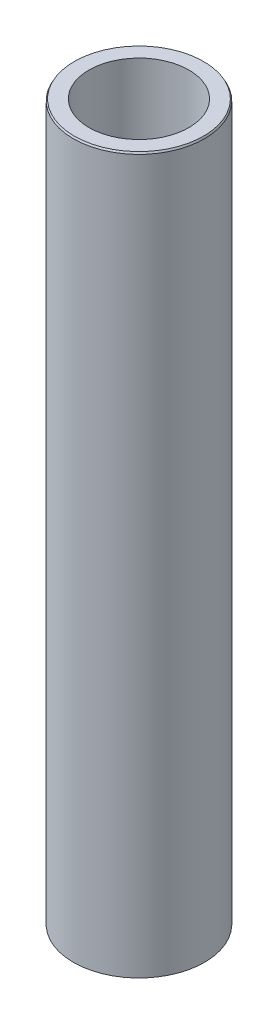
from build123d import *
from OCP.BRepFilletAPI import BRepFilletAPI_MakeChamfer

# Parameters (mm, degrees)
SKETCH1_R           = 55
BOSS_EXTRUDE1_DEPTH = 600
SKETCH2_R           = 41.846324563
CUT_EXTRUDE1_DEPTH  = 606.020660804
CHAMFER1_SIZE       = 1.471821638
CHAMFER1_SIZE2      = 0.810370983


with BuildPart() as part:
    # Sketch1 → Boss-Extrude1 (new body)
    with BuildSketch(Plane(origin=(0, 0, 0), x_dir=(1, 0, 0), z_dir=(0, 1, 0))):
        Circle(SKETCH1_R)
    extrude(amount=BOSS_EXTRUDE1_DEPTH)

    # Sketch2 → Cut-Extrude1 (cut, through all)
    with BuildSketch(Plane(origin=(0, 0, 0), x_dir=(1, 0, 0), z_dir=(0, 1, 0))):
        Circle(SKETCH2_R)
    extrude(amount=CUT_EXTRUDE1_DEPTH, mode=Mode.SUBTRACT)

    # Chamfer1: one chamfer whose edges measure the first distance from different faces: ONE call of the kernel's chamfer builder (chamfer() names one face for all edges)
    chamfer1_edges_1 = [part.edges().sort_by_distance(p)[0] for p in [
        (-55, 600, 0),
    ]]
    chamfer1_side_1 = [part.faces().sort_by_distance(p)[0] for p in [
        (-55, 300, 0),
    ]]
    chamfer1_edges_2 = [part.edges().sort_by_distance(p)[0] for p in [
        (-55, 0, 0),
    ]]
    chamfer1_side_2 = [part.faces().sort_by_distance(p)[0] for p in [
        (-53.444365081, 0, 0),
    ]]
    chamfer1 = BRepFilletAPI_MakeChamfer(part.part.solid().wrapped)
    for e in chamfer1_edges_1:
        chamfer1.Add(CHAMFER1_SIZE, CHAMFER1_SIZE2, e.wrapped, chamfer1_side_1[0].wrapped)  # the first distance lies on this face
    for e in chamfer1_edges_2:
        chamfer1.Add(CHAMFER1_SIZE, CHAMFER1_SIZE2, e.wrapped, chamfer1_side_2[0].wrapped)  # the first distance lies on this face
    add(Compound.cast(chamfer1.Shape()), mode=Mode.REPLACE)


solid = part.part
